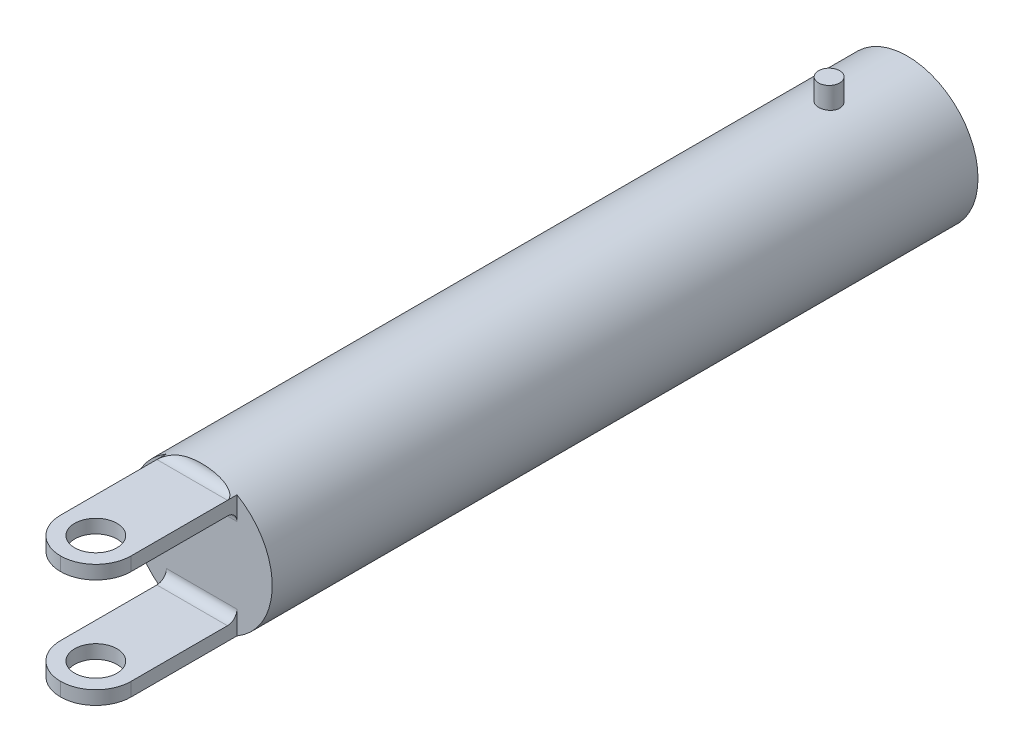
from build123d import *

# Parameters (mm, degrees)
SKETCH1_R           = 10
BOSS_EXTRUDE1_DEPTH = 100
SKETCH3_W           = 10
SKETCH3_H           = 1.929631273
BOSS_EXTRUDE3_DEPTH = 20
SKETCH4_R           = 3
CUT_EXTRUDE1_DEPTH  = 122.853211204
FILLET2_R           = 5
FILLET3_R           = 1.35
SKETCH7_R           = 1.5
BOSS_EXTRUDE4_DEPTH = 13


# Some blends are built 0.0001 mm under size
with BuildPart() as part:
    # Sketch1 → Boss-Extrude1 (new body)
    with BuildSketch(Plane(origin=(0, 0, 0), x_dir=(0, 1, 0), z_dir=(0, 0, 1))):
        with Locations(Location((0, 0, 0), (0, 0, 270))):
            Circle(SKETCH1_R)
    extrude(amount=BOSS_EXTRUDE1_DEPTH)

    # Sketch3 → Boss-Extrude3 (add)
    with BuildSketch(Plane.XY.offset(100)):
        with Locations((0, 7.695438402)):
            Rectangle(SKETCH3_W, SKETCH3_H)
        with Locations((0, -7.695438402)):
            Rectangle(SKETCH3_W, SKETCH3_H)
    extrude(amount=BOSS_EXTRUDE3_DEPTH)

    # Sketch4 → Cut-Extrude1 (cut, through all)
    with BuildSketch(Plane.XZ.offset(8.660254038)):
        with Locations(Location((0, 115, 0), (0, 0, 270))):
            Circle(SKETCH4_R)
    extrude(amount=-CUT_EXTRUDE1_DEPTH, mode=Mode.SUBTRACT)

    # Fillet2
    fillet2_edges = [part.edges().sort_by_distance(p)[0] for p in [
        (-5, 7.695438402, 120),
        (5, 7.695438402, 120),
        (-5, -7.695438402, 120),
        (5, -7.695438402, 120),
    ]]
    fillet(fillet2_edges, radius=FILLET2_R - 0.0001)  # a hair under: the kernel refuses the full size

    # Fillet3
    # the kernel refuses this fillet: 1.35 mm, written as the material it adds along each edge
    with BuildSketch(Plane(origin=(-5, -6.730622765, 100), x_dir=(0, 0, 1), z_dir=(1, 0, 0)), Plane(origin=(-5, 6.730622765, 100), x_dir=(0, -1, 0), z_dir=(1, 0, 0))) as fillet3_piece_1:
        with BuildLine():
            CenterArc((FILLET3_R, -FILLET3_R), FILLET3_R, 90, 90)
            Line((0, -FILLET3_R), (0, 0))
            Line((0, 0), (FILLET3_R, 0))
        make_face()
    extrude(amount=10)
    with BuildSketch(Plane(origin=(5, 8.660254038, 100), x_dir=(0, 1, 0), z_dir=(-1, 0, 0))) as fillet3_piece_2_section:
        with BuildLine():
            CenterArc((FILLET3_R, -FILLET3_R), FILLET3_R, 90, 90)
            Line((0, -FILLET3_R), (0, 0))
            Line((0, 0), (FILLET3_R, 0))
        make_face()
    fillet3_piece_2 = extrude(amount=10, mode=Mode.PRIVATE)
    fillet3_piece_2 = fillet3_piece_2 & Plane(origin=(0, 0, 100.331461228), x_dir=(1, 0, 0), z_dir=(0, 0, -1)) * Cylinder(10, 26, mode=Mode.PRIVATE)
    add(fillet3_piece_2)
    with BuildSketch(Plane(origin=(5, -8.660254038, 100), x_dir=(0, 0, 1), z_dir=(-1, 0, 0))) as fillet3_piece_3_section:
        with BuildLine():
            CenterArc((FILLET3_R, -FILLET3_R), FILLET3_R, 90, 90)
            Line((0, -FILLET3_R), (0, 0))
            Line((0, 0), (FILLET3_R, 0))
        make_face()
    fillet3_piece_3 = extrude(amount=10, mode=Mode.PRIVATE)
    fillet3_piece_3 = fillet3_piece_3 & Plane(origin=(0, 0, 100.331460994), x_dir=(1, 0, 0), z_dir=(0, 0, -1)) * Cylinder(10, 26, mode=Mode.PRIVATE)
    add(fillet3_piece_3)

    # Sketch7 → Boss-Extrude4 (add)
    with BuildSketch(Plane(origin=(0, 0, 0), x_dir=(-1, 0, 0), z_dir=(0, 1, 0))):
        with Locations(Location((0, 11.098495107, 0), (0, 0, 270))):
            Circle(SKETCH7_R)
    extrude(amount=BOSS_EXTRUDE4_DEPTH)


solid = part.part
